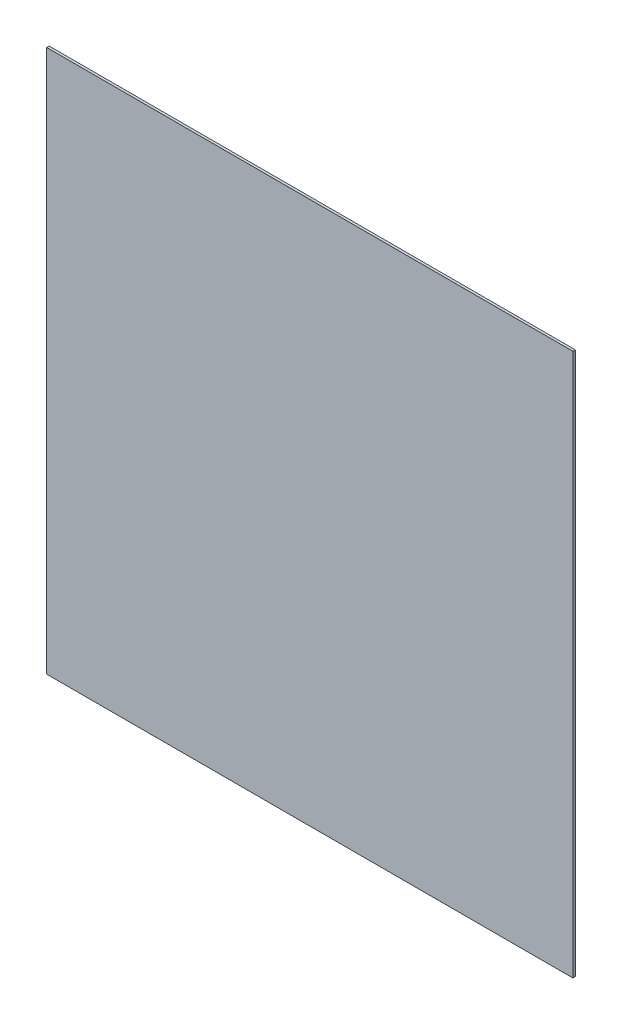
from build123d import *

# Parameters (mm, degrees)
SKETCH2_W           = 320
SKETCH2_H           = 330
BOSS_EXTRUDE2_DEPTH = 1.5


with BuildPart() as part:
    # Sketch2 → Boss-Extrude2 (new body)
    with BuildSketch(Plane.XY):
        with Locations((0, -5)):
            Rectangle(SKETCH2_W, SKETCH2_H)
    extrude(amount=BOSS_EXTRUDE2_DEPTH)


solid = part.part
